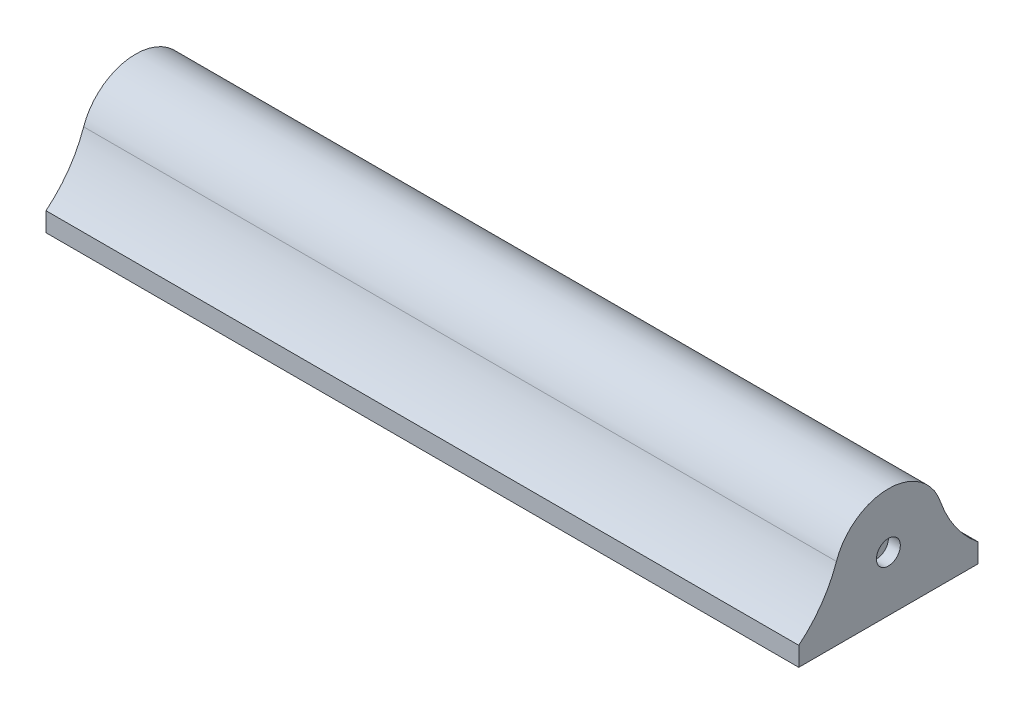
from build123d import *

# Parameters (mm, degrees)
SKETCH2_R           = 3
BOSS_EXTRUDE1_DEPTH = 63
FILLET1_R           = 10
SKETCH4_W           = 1
SKETCH4_H           = 2
LPATTERN1_COUNT     = 27
LPATTERN1_PITCH     = 2


with BuildPart() as part:
    # Sketch2 → Boss-Extrude1 (new body)
    with BuildSketch(Plane(origin=(0, 0, 0), x_dir=(0, 0, -1), z_dir=(1, 0, 0))):
        with BuildLine():
            Line((7.5, 0), (-7.5, 0))
            Line((-7.5, 0), (-7.5, 1.6))
            Line((-7.5, 1.6), (-4.6, 1.6))
            Line((-4.6, 1.6), (-4.6, 4.6))
            ThreePointArc((-4.6, 4.6), (0, 9.2), (4.6, 4.6))
            Line((4.6, 4.6), (4.6, 1.6))
            Line((4.6, 1.6), (7.5, 1.6))
            Line((7.5, 1.6), (7.5, 0))
        make_face()
        with Locations((0, 4.6)):
            Circle(SKETCH2_R, mode=Mode.SUBTRACT)
    extrude(amount=BOSS_EXTRUDE1_DEPTH)

    # Fillet1
    # the kernel refuses this fillet: 10 mm, written as the material it adds along each edge
    with BuildSketch(Plane(origin=(0, 1.6, 4.6), x_dir=(0, 0, 1), z_dir=(1, 0, 0))) as fillet1_piece_1:
        with BuildLine():
            CenterArc((9.2002873, -7.76571825), FILLET1_R, 129.052242215, 31.8961874)
            Line((-0.251964275, -4.501527668), (-1.197189433, -4.17510861))
            ThreePointArc((-1.197189433, -4.17510861), (-1, -3), (-1, 0))
            Line((-1, 0), (0, 1))
            ThreePointArc((0, 1), (1.45, 1), (2.26997127, 0.776571825))
            Line((2.26997127, 0.776571825), (2.9, 0))
        make_face()
    extrude(amount=63)
    with BuildSketch(Plane(origin=(0, 1.6, -4.6), x_dir=(0, 0.9984371795736424, 0.05588558351695166), z_dir=(1, 0, 0))) as fillet1_piece_2:
        with BuildLine():
            CenterArc((7.239418403, -9.619900599), FILLET1_R, 105.847893216, 31.8961874)
            Line((-0.162068192, -2.895467821), (-0.902216852, -2.223024543))
            ThreePointArc((-0.902216852, -2.223024543), (-1.079471276, -1.391848327), (-0.99843718, 0.055885584))
            Line((-0.99843718, 0.055885584), (0.055885584, 0.99843718))
            ThreePointArc((0.055885584, 0.99843718), (3.051197122, 0.830780429), (4.235489295, 0.96199006))
            Line((4.235489295, 0.96199006), (4.508573759, 0))
        make_face()
    extrude(amount=63)

    # Sketch4 → Revolve1 (revolve)
    with BuildSketch(Plane.XY, mode=Mode.PRIVATE) as revolve1_sk:
        with Locations((62.5, 6.6)):
            Rectangle(SKETCH4_W, SKETCH4_H)
    revolve1 = revolve(revolve1_sk.sketch.rotate(Axis((63, 4.6, 0), (-1, 0, 0)), 180), axis=Axis((63, 4.6, 0), (-1, 0, 0)))

    # LPattern1: Revolve1 ×27
    with Locations(*[(-i * LPATTERN1_PITCH, 0, 0) for i in range(1, LPATTERN1_COUNT)]):
        add(revolve1)


solid = part.part
